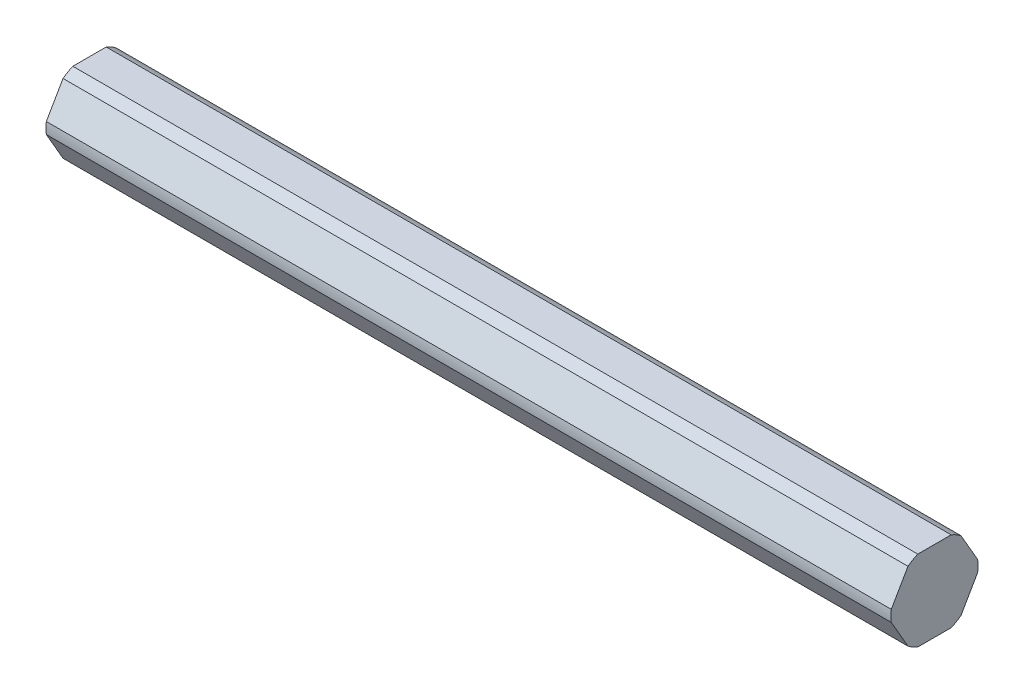
from build123d import *

# Parameters (mm, degrees)
BOSS_EXTRUDE1_DEPTH = 66.675


with BuildPart() as part:
    # Sketch1 → Boss-Extrude1 (new, symmetric)
    with BuildSketch(Plane(origin=(0, 0, 0), x_dir=(0, 0, -1), z_dir=(1, 0, 0))):
        with BuildLine():
            Line((2.634981025, 6.35), (-2.634981025, 6.35))
            ThreePointArc((-2.634981025, 6.35), (-3.4375, 5.953924651), (-4.181770802, 5.456960506))
            Line((-4.181770802, 5.456960506), (-6.816751826, 0.893039494))
            ThreePointArc((-6.816751826, 0.893039494), (-6.875, 0), (-6.816751826, -0.893039494))
            Line((-6.816751826, -0.893039494), (-4.181770802, -5.456960506))
            ThreePointArc((-4.181770802, -5.456960506), (-3.4375, -5.953924651), (-2.634981025, -6.35))
            Line((-2.634981025, -6.35), (2.634981025, -6.35))
            ThreePointArc((2.634981025, -6.35), (3.4375, -5.953924651), (4.181770802, -5.456960506))
            Line((4.181770802, -5.456960506), (6.816751826, -0.893039494))
            ThreePointArc((6.816751826, -0.893039494), (6.875, 0), (6.816751826, 0.893039494))
            Line((6.816751826, 0.893039494), (4.181770802, 5.456960506))
            ThreePointArc((4.181770802, 5.456960506), (3.4375, 5.953924651), (2.634981025, 6.35))
        make_face()
    extrude(amount=BOSS_EXTRUDE1_DEPTH, both=True)


solid = part.part
